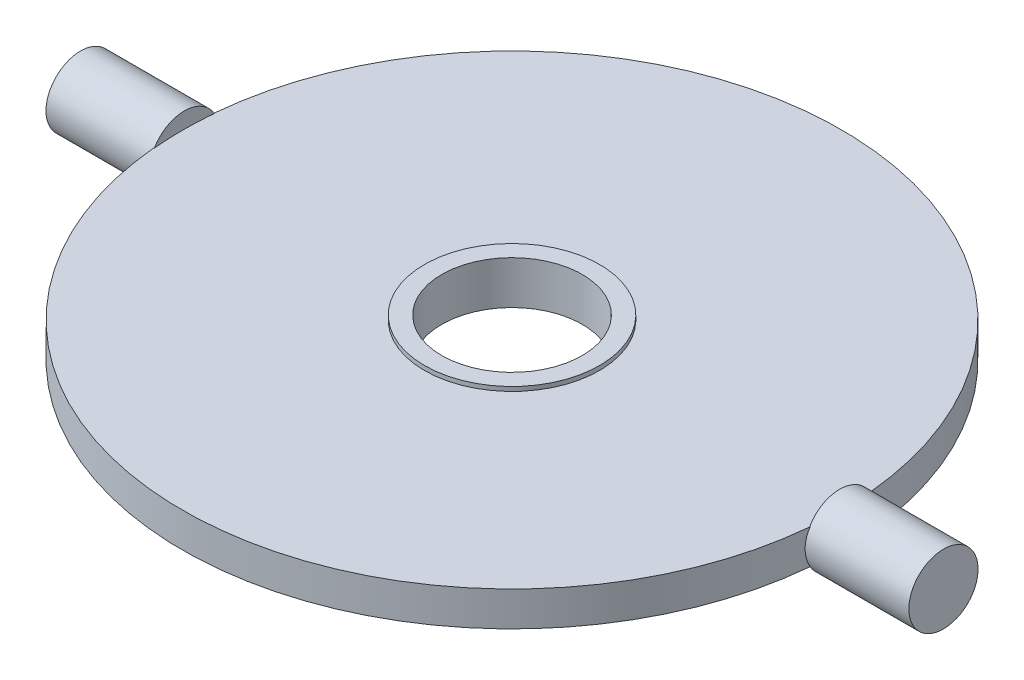
from build123d import *

# Parameters (mm, degrees)
SKETCH1_R           = 10.125
BOSS_EXTRUDE1_DEPTH = 2
SKETCH1_7_R         = 10.125
SKETCH1_7_R_2       = 8.125
BOSS_EXTRUDE2_DEPTH = 2.5


with BuildPart() as part:
    # Sketch1 → Boss-Extrude1 (new, symmetric)
    with BuildSketch(Plane(origin=(0, 0, 0), x_dir=(1, 0, 0), z_dir=(0, 1, 0))):
        with BuildLine():
            ThreePointArc((37.88944444, 4), (0, 38.1), (-37.88944444, 4))
            ThreePointArc((-37.88944444, 4), (-38.047324697, 2.002768936), (-38.1, 0))
            ThreePointArc((-38.1, 0), (-38.047324697, -2.002768936), (-37.88944444, -4))
            ThreePointArc((-37.88944444, -4), (0, -38.1), (37.88944444, -4))
            ThreePointArc((37.88944444, -4), (38.047324697, -2.002768936), (38.1, 0))
            ThreePointArc((38.1, 0), (38.047324697, 2.002768936), (37.88944444, 4))
        make_face()
        Circle(SKETCH1_R, mode=Mode.SUBTRACT)
    extrude(amount=BOSS_EXTRUDE1_DEPTH, both=True)

    # Sketch1<6> → Revolve1 (revolve)
    with BuildSketch(Plane(origin=(0, 0, 0), x_dir=(1, 0, 0), z_dir=(0, 1, 0))):
        with BuildLine():
            Line((-38.1, 0), (-49.88944444, 0))
            Line((-49.88944444, 0), (-49.88944444, -4))
            Line((-49.88944444, -4), (-37.88944444, -4))
            ThreePointArc((-37.88944444, -4), (-38.047324697, -2.002768936), (-38.1, 0))
        make_face()
        with BuildLine():
            Line((49.88944444, 0), (38.1, 0))
            ThreePointArc((38.1, 0), (38.047324697, -2.002768936), (37.88944444, -4))
            Line((37.88944444, -4), (49.88944444, -4))
            Line((49.88944444, -4), (49.88944444, 0))
        make_face()
    revolve(axis=Axis((-76.43543075, 0, 0), (1, 0, 0)))

    # Sketch1<7> → Boss-Extrude2 (add, symmetric)
    with BuildSketch(Plane(origin=(0, 0, 0), x_dir=(1, 0, 0), z_dir=(0, 1, 0))):
        Circle(SKETCH1_7_R)
        Circle(SKETCH1_7_R_2, mode=Mode.SUBTRACT)
    extrude(amount=BOSS_EXTRUDE2_DEPTH, both=True)


solid = part.part
